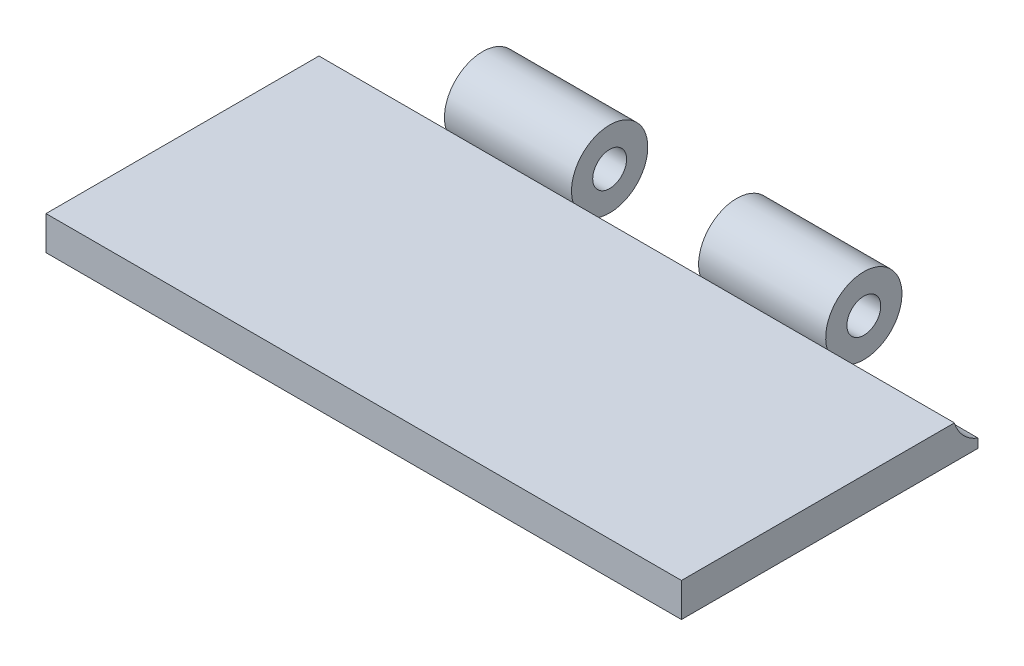
from build123d import *

# Parameters (mm, degrees)
SKETCH1_W           = 150
SKETCH1_H           = 70
BOSS_EXTRUDE1_DEPTH = 8
BOSS_EXTRUDE3_START = -30
SKETCH2_R           = 9
BOSS_EXTRUDE3_DEPTH = 30
LPATTERN2_COUNT     = 2
LPATTERN2_PITCH     = 60
CUT_EXTRUDE1_START  = 30
SKETCH5_R           = 9
CUT_EXTRUDE1_DEPTH  = 30
CUT_EXTRUDE2_START  = -30
SKETCH6_R           = 9
CUT_EXTRUDE2_DEPTH  = 30
CUT_EXTRUDE3_START  = -90
SKETCH7_R           = 9
CUT_EXTRUDE3_DEPTH  = 30
SCALE1_SCALE        = 0.333333333


with BuildPart() as part:
    # Sketch1 → Boss-Extrude1 (new body)
    with BuildSketch(Plane(origin=(0, 0, 0), x_dir=(1, 0, 0), z_dir=(0, 1, 0))):
        with Locations((-26.196172249, -15.418660287)):
            Rectangle(SKETCH1_W, SKETCH1_H)
    extrude(amount=BOSS_EXTRUDE1_DEPTH)

    # Sketch2 → Boss-Extrude3 (add)
    with BuildSketch(Plane.ZY.offset(101.196172249).offset(BOSS_EXTRUDE3_START)):
        with Locations((-22.631021545, 10.588327785)):
            Circle(SKETCH2_R)
        with BuildLine():
            ThreePointArc((-19.581339713, 8), (-26.385933483, 11.966963465), (-18.631021545, 10.588327785))
            ThreePointArc((-18.631021545, 10.588327785), (-18.876109607, 9.209692106), (-19.581339713, 8))
        make_face(mode=Mode.SUBTRACT)
    boss_extrude3 = extrude(amount=-BOSS_EXTRUDE3_DEPTH)

    # LPattern2: Boss-Extrude3 ×2
    with Locations(*[(i * LPATTERN2_PITCH, 0, 0) for i in range(1, LPATTERN2_COUNT)]):
        add(boss_extrude3)

    # Sketch5 → Cut-Extrude1 (cut)
    with BuildSketch(Plane.ZY.offset(71.196172249).offset(CUT_EXTRUDE1_START)):
        with Locations((-22.631021545, 10.588327785)):
            Circle(SKETCH5_R)
    extrude(amount=-CUT_EXTRUDE1_DEPTH, mode=Mode.SUBTRACT)

    # Sketch6 → Cut-Extrude2 (cut)
    with BuildSketch(Plane.ZY.offset(71.196172249).offset(CUT_EXTRUDE2_START)):
        with Locations((-22.631021545, 10.588327785)):
            Circle(SKETCH6_R)
    extrude(amount=-CUT_EXTRUDE2_DEPTH, mode=Mode.SUBTRACT)

    # Sketch7 → Cut-Extrude3 (cut)
    with BuildSketch(Plane.ZY.offset(71.196172249).offset(CUT_EXTRUDE3_START)):
        with Locations((-22.631021545, 10.588327785)):
            Circle(SKETCH7_R)
    extrude(amount=-CUT_EXTRUDE3_DEPTH, mode=Mode.SUBTRACT)


with BuildPart() as part_1:
    # Scale1: scaled about (-26.196172249, 4.807290531, 11.552118014)
    add(part.part.scale(SCALE1_SCALE).moved(Location((-17.464114833, 3.204860354, 7.701412009))))


solid = part_1.part
